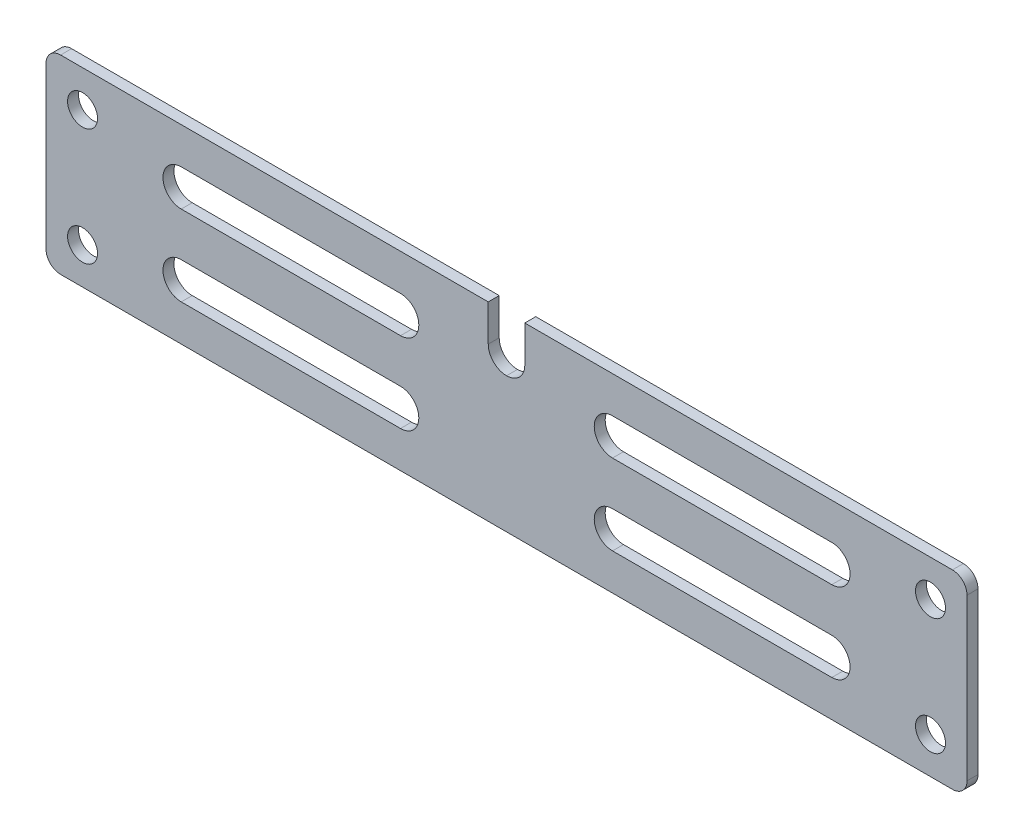
from build123d import *

# Parameters (mm, degrees)
SKETCH_1_W          = 126
SKETCH_1_H          = 26
EXTRUDE_1_DEPTH     = 1.5
FILLET_1_R          = 2
SKETCH_2_W          = 5
SKETCH_2_H          = 15
CUT_EXTRUDE_1_DEPTH = 65.344774458
FILLET_2_R          = 2.5
CUT_EXTRUDE_2_DEPTH = 65.344774458
SKETCH_4_R          = 2.05
CUT_EXTRUDE_3_DEPTH = 65.344774458


with BuildPart() as part:
    # 草图1 → 凸台-拉伸1 (new body)
    with BuildSketch(Plane.XY):
        Rectangle(SKETCH_1_W, SKETCH_1_H)
    extrude(amount=EXTRUDE_1_DEPTH)

    # 圆角1
    fillet_1_edges = [part.edges().sort_by_distance(p)[0] for p in [
        (-63, 13, 0.75),
        (63, 13, 0.75),
        (63, -13, 0.75),
        (-63, -13, 0.75),
    ]]
    fillet(fillet_1_edges, radius=FILLET_1_R)

    # 草图2 → 切除-拉伸1 (cut, through all)
    with BuildSketch(Plane.XY.offset(1.5)):
        with Locations((0, 13)):
            Rectangle(SKETCH_2_W, SKETCH_2_H)
    extrude(amount=-CUT_EXTRUDE_1_DEPTH, mode=Mode.SUBTRACT)

    # 圆角2
    fillet_2_edges = [part.edges().sort_by_distance(p)[0] for p in [
        (2.5, 5.5, 0.75),
        (-2.5, 5.5, 0.75),
    ]]
    fillet(fillet_2_edges, radius=FILLET_2_R - 0.0001)  # a hair under: the kernel refuses the full size

    # 草图3 → 切除-拉伸2 (cut, through all)
    with BuildSketch(Plane.XY.offset(1.5)):
        with BuildLine():
            Line((-44.5, 8), (-14.5, 8))
            ThreePointArc((-14.5, 8), (-12, 5.5), (-14.5, 3))
            Line((-14.5, 3), (-44.5, 3))
            ThreePointArc((-44.5, 3), (-47, 5.5), (-44.5, 8))
        make_face()
        with BuildLine():
            Line((14.5, 8), (44.5, 8))
            ThreePointArc((44.5, 8), (47, 5.5), (44.5, 3))
            Line((44.5, 3), (14.5, 3))
            ThreePointArc((14.5, 3), (12, 5.5), (14.5, 8))
        make_face()
        with BuildLine():
            Line((14.5, -3), (44.5, -3))
            ThreePointArc((44.5, -3), (47, -5.5), (44.5, -8))
            Line((44.5, -8), (14.5, -8))
            ThreePointArc((14.5, -8), (12, -5.5), (14.5, -3))
        make_face()
        with BuildLine():
            Line((-44.5, -3), (-14.5, -3))
            ThreePointArc((-14.5, -3), (-12, -5.5), (-14.5, -8))
            Line((-14.5, -8), (-44.5, -8))
            ThreePointArc((-44.5, -8), (-47, -5.5), (-44.5, -3))
        make_face()
    extrude(amount=-CUT_EXTRUDE_2_DEPTH, mode=Mode.SUBTRACT)

    # 草图4 → 切除-拉伸3 (cut, through all)
    with BuildSketch(Plane.XY.offset(1.5)):
        with Locations((58, -8)):
            Circle(SKETCH_4_R)
        with Locations((58, 8)):
            Circle(SKETCH_4_R)
        with Locations((-58, 8)):
            Circle(SKETCH_4_R)
        with Locations((-58, -8)):
            Circle(SKETCH_4_R)
    extrude(amount=-CUT_EXTRUDE_3_DEPTH, mode=Mode.SUBTRACT)


solid = part.part
